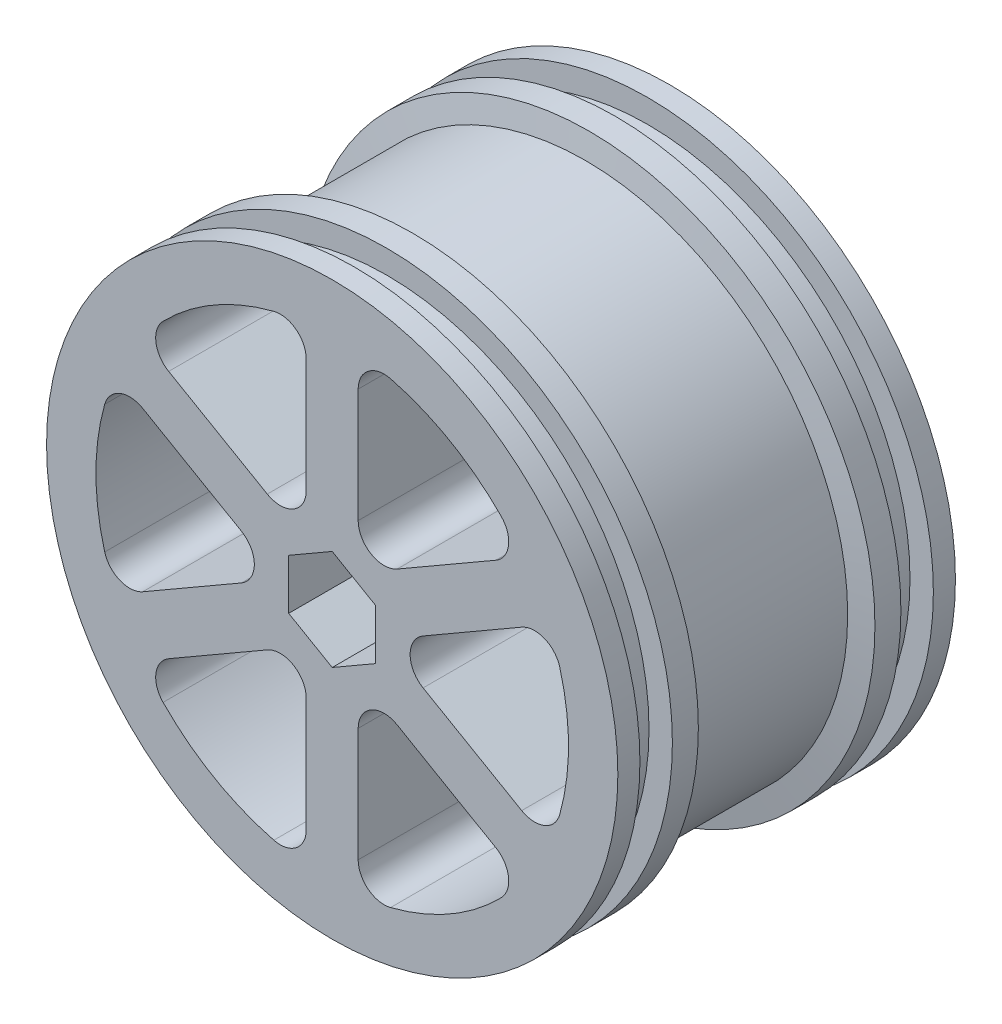
from build123d import *

# Parameters (mm, degrees)
SKETCH2_W               = 4
SKETCH2_H               = 18.2
BOSS_EXTRUDE1_DEPTH     = 24
CIRPATTERN1_COUNT       = 6
CUT_EXTRUDE1_DEPTH      = 41.546269865
CUT_EXTRUDE1_DEPTH_BACK = 41.546269865
FILLET1_R               = 2
FILLET2_R               = 2


with BuildPart() as part:
    # Sketch1 → Revolve1 (revolve)
    with BuildSketch(Plane(origin=(0, 0, 0), x_dir=(0, 0, -1), z_dir=(1, 0, 0)), mode=Mode.PRIVATE) as revolve1_sk:
        Polygon((0, 22), (1.7, 22), (1.7, 20.2), (4.2, 20.2), (4.2, 22), (6.2, 22), (6.5, 20.2), (19.5, 20.2), (19.8, 22), (21.8, 22), (21.8, 20.2), (24.3, 20.2), (24.3, 22), (26, 22), (26, 18.2), (0, 18.2), align=None)
    revolve(revolve1_sk.sketch.rotate(Axis((0, 0, 0.322174052), (0, 0, -1)), 90), axis=Axis((0, 0, 0.322174052), (0, 0, -1)))

    # Sketch2 → Boss-Extrude1 (add)
    with BuildSketch(Plane.XY):
        with Locations((0, 9.1)):
            Rectangle(SKETCH2_W, SKETCH2_H)
    boss_extrude1 = extrude(amount=-BOSS_EXTRUDE1_DEPTH)

    # CirPattern1: Boss-Extrude1 ×6 about axis
    cirpattern1_axis = Axis((0, 0, 0), (0, 0, 1))
    for i in range(1, CIRPATTERN1_COUNT):
        add(boss_extrude1.rotate(cirpattern1_axis, i * 360 / CIRPATTERN1_COUNT))

    # Sketch3 → Cut-Extrude1 (cut, two sides: drawn at the far end of the back side and taken through both)
    with BuildSketch(Plane.XY.offset(-CUT_EXTRUDE1_DEPTH_BACK)):
        Polygon((0, -3.87), (3.351518313, -1.935), (3.351518313, 1.935), (0, 3.87), (-3.351518313, 1.935), (-3.351518313, -1.935), align=None)
    extrude(amount=CUT_EXTRUDE1_DEPTH + CUT_EXTRUDE1_DEPTH_BACK, mode=Mode.SUBTRACT)

    # Fillet1
    fillet1_edges = [part.edges().sort_by_distance(p)[0] for p in [
        (14.666205667, 10.776938867, -12),
        (-14.666205667, 10.776938867, -12),
        (-2, 18.089776118, -12),
        (2, 18.089776118, -12),
        (-16.666205667, 7.312837251, -12),
        (-14.666205667, -10.776938867, -12),
        (-16.666205667, -7.312837251, -12),
        (2, -18.089776118, -12),
        (-2, -18.089776118, -12),
        (14.666205667, -10.776938867, -12),
        (16.666205667, -7.312837251, -12),
        (16.666205667, 7.312837251, -12),
        (4, 0, -12),
        (2, -3.464101615, -12),
        (-2, -3.464101615, -12),
        (-4, 0, -12),
        (2, 3.464101615, -12),
        (-2, 3.464101615, -12),
    ]]
    fillet(fillet1_edges, radius=FILLET1_R)

    # Fillet2
    fillet2_edges = [part.edges().sort_by_distance(p)[0] for p in [
        (-18.2, 0, -26),
    ]]
    fillet(fillet2_edges, radius=FILLET2_R - 0.0001)  # a hair under: the kernel refuses the full size


solid = part.part
